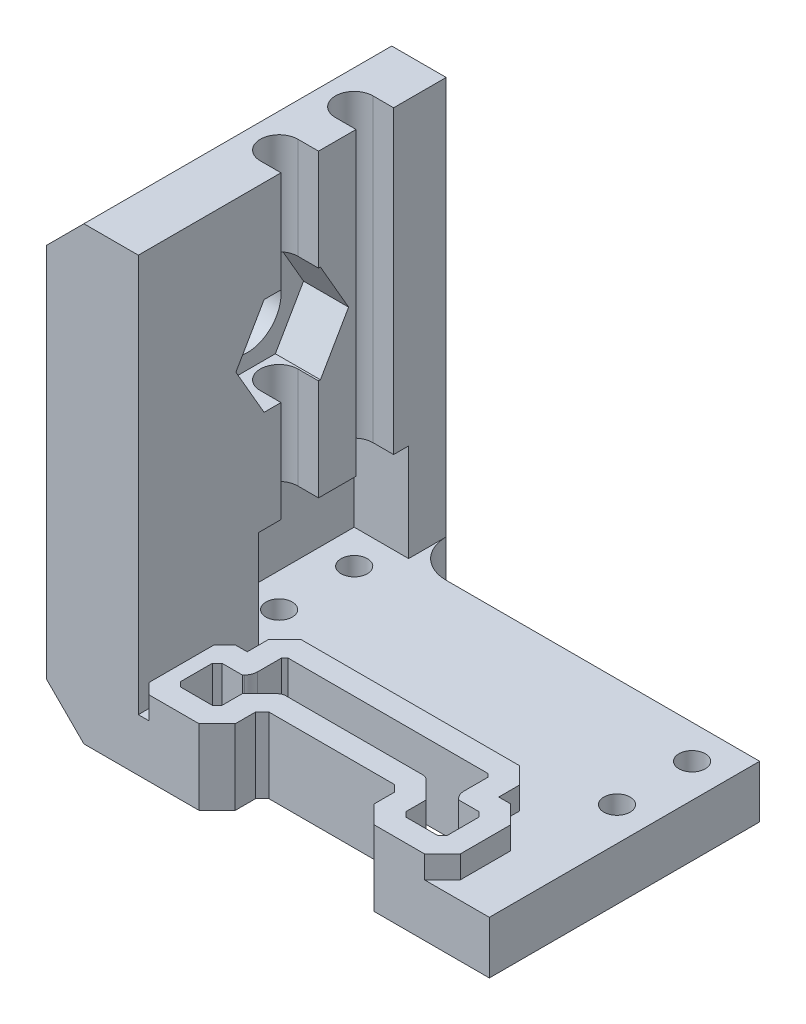
from build123d import *

# Parameters (mm, degrees)
BOSS_EXTRUDE1_DEPTH = 400
BOSS_EXTRUDE2_DEPTH = 10
SKETCH3_R           = 43.000999871
CUT_EXTRUDE1_DEPTH  = 447.360216168
BOSS_EXTRUDE3_DEPTH = 7
SKETCH5_R           = 1.75
CUT_EXTRUDE2_DEPTH  = 33
SKETCH6_W           = 36.000000185
SKETCH6_H           = 60
BOSS_EXTRUDE4_DEPTH = 5
SKETCH7_W           = 7.24997928
SKETCH7_H           = 16
BOSS_EXTRUDE5_DEPTH = 53
SKETCH8_W           = 12.24997928
SKETCH8_H           = 60
BOSS_EXTRUDE6_DEPTH = 5
FILLET1_R           = 5
SKETCH10_W          = 20.000000185
SKETCH10_H          = 40
BOSS_EXTRUDE7_DEPTH = 7.24997928
CUT_EXTRUDE3_DEPTH  = 6
CUT_EXTRUDE4_DEPTH  = 68.845857758
SKETCH12_R          = 4.5
CUT_EXTRUDE5_DEPTH  = 16
CHAMFER2_SIZE       = 5
CHAMFER3_SIZE       = 5
SKETCH13_R          = 6.5
SKETCH13_R_2        = 4.5
BOSS_EXTRUDE8_DEPTH = 1
FILLET2_R           = 1


with BuildPart() as part:
    # Sketch1 → Boss-Extrude1 (new body)
    with BuildSketch(Plane(origin=(0, 200, 0), x_dir=(1, 0, 0), z_dir=(0, 1, 0))):
        with BuildLine():
            Line((1e-09, -3.855700002), (0.25, -4.00003757))
            Line((0.25, -4.00003757), (9.078700232, -4.00003757))
            ThreePointArc((9.078700232, -4.00003757), (9.652725366, -4.114218268), (10.139360377, -4.439377387))
            Line((10.139360377, -4.439377387), (12.500020747, -6.800037757))
            Line((12.500020747, -6.800037757), (12.500020747, -9.500037757))
            Line((12.500020747, -9.500037757), (13.00002072, -10.000037755))
            Line((13.00002072, -10.000037755), (17.00002072, -10.000037755))
            Line((17.00002072, -10.000037755), (17.500020747, -9.500037752))
            Line((17.500020747, -9.500037752), (17.500020747, -5.500037752))
            Line((17.500020747, -5.500037752), (17.00002075, -5.0000377))
            Line((17.00002075, -5.0000377), (14.30002072, -5.0000377))
            Line((14.30002072, -5.0000377), (14.085807141, -4.785824121))
            ThreePointArc((14.085807141, -4.785824121), (13.652261651, -4.136977442), (13.50002072, -3.371610598))
            Line((13.50002072, -3.371610598), (13.50002072, -0.30003757))
            Line((13.50002072, -0.30003757), (13.20002072, -3.757e-05))
            Line((13.20002072, -3.757e-05), (7.50002072, -3.757e-05))
            Line((7.50002072, -3.757e-05), (7.40002072, -0.10003757))
            Line((7.40002072, -0.10003757), (-7.40002072, -0.10003757))
            Line((-7.40002072, -0.10003757), (-7.50002072, -3.757e-05))
            Line((-7.50002072, -3.757e-05), (-13.20002072, -3.757e-05))
            Line((-13.20002072, -3.757e-05), (-13.50002072, -0.30003757))
            Line((-13.50002072, -0.30003757), (-13.50002072, -3.371610628))
            ThreePointArc((-13.50002072, -3.371610628), (-13.652261651, -4.136977472), (-14.085807141, -4.785824151))
            Line((-14.085807141, -4.785824151), (-14.30002069, -5.0000377))
            Line((-14.30002069, -5.0000377), (-17.00002072, -5.0000377))
            Line((-17.00002072, -5.0000377), (-17.50002072, -5.50003767))
            Line((-17.50002072, -5.50003767), (-17.50002072, -9.50003767))
            Line((-17.50002072, -9.50003767), (-17.000020665, -10.000037755))
            Line((-17.000020665, -10.000037755), (-13.00002072, -10.000037755))
            Line((-13.00002072, -10.000037755), (-12.500020741, -9.500037764))
            Line((-12.500020741, -9.500037764), (-12.500020741, -6.800037764))
            Line((-12.500020741, -6.800037764), (-10.139360364, -4.439377387))
            ThreePointArc((-10.139360364, -4.439377387), (-9.652725352, -4.114218268), (-9.078700218, -4.00003757))
            Line((-9.078700218, -4.00003757), (-0.25, -4.00003757))
            Line((-0.25, -4.00003757), (1e-09, -3.855700002))
        make_face()
    extrude(amount=-BOSS_EXTRUDE1_DEPTH)

    # Sketch3 → Cut-Extrude1 (cut)
    with BuildSketch(Plane(origin=(0, 200, 0), x_dir=(1, 0, 0), z_dir=(0, 1, 0))):
        with Locations((0, -0.10003757)):
            Circle(SKETCH3_R)
    extrude(amount=-CUT_EXTRUDE1_DEPTH, mode=Mode.SUBTRACT)


with BuildPart() as body_2:
    # Sketch2 → Boss-Extrude2 (new body)
    with BuildSketch(Plane(origin=(0, 210, 0), x_dir=(1, 0, 0), z_dir=(0, 1, 0))):
        Polygon((-8.353826469, -7.25003757), (8.353826482, -7.25003757), (9.250020747, -8.146231835), (9.250020747, -10.846231788), (11.653826595, -13.250037755), (18.34621475, -13.250037755), (20.750020747, -10.846231878), (20.750020747, -4.153843779), (18.346214932, -1.7500377), (16.75002072, -1.7500377), (16.75002072, 1.046156508), (14.546214798, 3.24996243), (-14.546214798, 3.24996243), (-16.75002072, 1.046156508), (-16.75002072, -1.7500377), (-18.346214741, -1.7500377), (-20.75002072, -4.153843535), (-20.75002072, -10.846231691), (-18.3462148, -13.250037755), (-11.653826621, -13.250037755), (-9.250020741, -10.846231821), (-9.250020741, -8.146231842), align=None)
        with BuildLine():
            Line((13.303574111, 0.24996243), (-13.303574111, 0.24996243))
            Line((-13.303574111, 0.24996243), (-13.75002072, -0.196484179))
            Line((-13.75002072, -0.196484179), (-13.75002072, -3.371610628))
            ThreePointArc((-13.75002072, -3.371610628), (-13.883231534, -4.041306614), (-14.262583837, -4.609047456))
            Line((-14.262583837, -4.609047456), (-14.403574081, -4.7500377))
            Line((-14.403574081, -4.7500377), (-17.103574106, -4.7500377))
            Line((-17.103574106, -4.7500377), (-17.75002072, -5.396484275))
            Line((-17.75002072, -5.396484275), (-17.75002072, -9.603591056))
            Line((-17.75002072, -9.603591056), (-17.10357406, -10.250037755))
            Line((-17.10357406, -10.250037755), (-12.896467328, -10.250037755))
            Line((-12.896467328, -10.250037755), (-12.250020741, -9.603591153))
            Line((-12.250020741, -9.603591153), (-12.250020741, -6.903591155))
            Line((-12.250020741, -6.903591155), (-9.962583668, -4.616154083))
            ThreePointArc((-9.962583668, -4.616154083), (-9.557054494, -4.345188152), (-9.078700218, -4.25003757))
            Line((-9.078700218, -4.25003757), (9.078700232, -4.25003757))
            ThreePointArc((9.078700232, -4.25003757), (9.557054508, -4.345188152), (9.962583682, -4.616154083))
            Line((9.962583682, -4.616154083), (12.250020747, -6.903591148))
            Line((12.250020747, -6.903591148), (12.250020747, -9.603591144))
            Line((12.250020747, -9.603591144), (12.896467326, -10.250037755))
            Line((12.896467326, -10.250037755), (17.103574107, -10.250037755))
            Line((17.103574107, -10.250037755), (17.750020747, -9.603591147))
            Line((17.750020747, -9.603591147), (17.750020747, -5.39648437))
            Line((17.750020747, -5.39648437), (17.103574149, -4.7500377))
            Line((17.103574149, -4.7500377), (14.403574111, -4.7500377))
            Line((14.403574111, -4.7500377), (14.262583837, -4.609047426))
            ThreePointArc((14.262583837, -4.609047426), (13.883231534, -4.041306584), (13.75002072, -3.371610598))
            Line((13.75002072, -3.371610598), (13.75002072, -0.196484179))
            Line((13.75002072, -0.196484179), (13.303574111, 0.24996243))
        make_face(mode=Mode.SUBTRACT)
    extrude(amount=BOSS_EXTRUDE2_DEPTH)

    # Sketch4 → Boss-Extrude3 (add)
    with BuildSketch(Plane(origin=(0, 210, 0), x_dir=(-1, 0, 0), z_dir=(0, -1, 0))):
        Polygon((27, -13.250037755), (27, 22.74996243), (-27, 22.74996243), (-27, -13.250037755), (-18.34621475, -13.250037755), (-20.750020747, -10.846231878), (-20.750020747, -4.153843779), (-18.346214932, -1.7500377), (-16.75002072, -1.7500377), (-16.75002072, 1.046156508), (-14.546214798, 3.24996243), (14.546214798, 3.24996243), (16.75002072, 1.046156508), (16.75002072, -1.7500377), (18.346214741, -1.7500377), (20.75002072, -4.153843535), (20.75002072, -10.846231691), (18.3462148, -13.250037755), align=None)
    extrude(amount=-BOSS_EXTRUDE3_DEPTH)

    # Sketch5 → Cut-Extrude2 (cut)
    with BuildSketch(Plane(origin=(0, 210, 0), x_dir=(-1, 0, 0), z_dir=(0, -1, 0))):
        with Locations(Location((22.5, 18.24996243, 0), (0, 0, 90))):
            Circle(SKETCH5_R)
        with Locations(Location((22.5, 8.24996243, 0), (0, 0, 90))):
            Circle(SKETCH5_R)
        with Locations(Location((-22.5, 8.24996243, 0), (0, 0, 90))):
            Circle(SKETCH5_R)
        with Locations(Location((-22.5, 18.24996243, 0), (0, 0, 90))):
            Circle(SKETCH5_R)
    extrude(amount=-CUT_EXTRUDE2_DEPTH, mode=Mode.SUBTRACT)

    # Sketch6 → Boss-Extrude4 (add)
    with BuildSketch(Plane.ZY.offset(27)):
        with Locations((-4.749962337, 240)):
            Rectangle(SKETCH6_W, SKETCH6_H)
    extrude(amount=BOSS_EXTRUDE4_DEPTH)

    # Sketch7 → Boss-Extrude5 (add)
    with BuildSketch(Plane(origin=(0, 217, 0), x_dir=(1, 0, 0), z_dir=(0, 1, 0))):
        with Locations((-23.37501036, -5.250037755)):
            Rectangle(SKETCH7_W, SKETCH7_H)
    extrude(amount=BOSS_EXTRUDE5_DEPTH)

    # Sketch8 → Boss-Extrude6 (add)
    with BuildSketch(Plane(origin=(0, 0, -22.74996243), x_dir=(-1, 0, 0), z_dir=(0, 0, -1))):
        with Locations((25.87501036, 240)):
            Rectangle(SKETCH8_W, SKETCH8_H)
    extrude(amount=BOSS_EXTRUDE6_DEPTH)

    # Fillet1
    fillet1_edges = [body_2.edges().sort_by_distance(p)[0] for p in [
        (-19.75002072, 213.5, -22.74996243),
    ]]
    fillet(fillet1_edges, radius=FILLET1_R - 0.0001)  # a hair under: the kernel refuses the full size

    # Sketch10 → Boss-Extrude7 (add)
    with BuildSketch(Plane(origin=(-27, 0, 0), x_dir=(0, 0, -1), z_dir=(1, 0, 0))):
        with Locations((12.749962337, 250)):
            Rectangle(SKETCH10_W, SKETCH10_H)
    extrude(amount=BOSS_EXTRUDE7_DEPTH)

    # Sketch9 → Cut-Extrude3 (cut)
    with BuildSketch(Plane(origin=(-19.75002072, 0, 0), x_dir=(0, 0, -1), z_dir=(1, 0, 0))):
        Polygon((14.755515837, 250), (11.002739087, 256.5), (3.497185588, 256.5), (-0.255591162, 250), (3.497185588, 243.5), (11.002739087, 243.5), align=None)
    extrude(amount=-CUT_EXTRUDE3_DEPTH, mode=Mode.SUBTRACT)

    # Sketch11 → Cut-Extrude4 (cut, through all)
    with BuildSketch(Plane(origin=(0, 217, 0), x_dir=(1, 0, 0), z_dir=(0, 1, 0))):
        with BuildLine():
            Line((-22.5, 20.74996243), (-17.824832595, 20.74996243))
            Line((-17.824832595, 20.74996243), (-17.824832595, 15.74996243))
            Line((-17.824832595, 15.74996243), (-22.5, 15.74996243))
            ThreePointArc((-22.5, 15.74996243), (-25, 18.24996243), (-22.5, 20.74996243))
        make_face()
        with BuildLine():
            Line((-22.5, 10.74996243), (-17.824832595, 10.74996243))
            Line((-17.824832595, 10.74996243), (-17.824832595, 5.74996243))
            Line((-17.824832595, 5.74996243), (-22.5, 5.74996243))
            ThreePointArc((-22.5, 5.74996243), (-25, 8.24996243), (-22.5, 10.74996243))
        make_face()
    extrude(amount=CUT_EXTRUDE4_DEPTH, mode=Mode.SUBTRACT)

    # Sketch12 → Cut-Extrude5 (cut)
    with BuildSketch(Plane(origin=(-25.75002072, 0, 0), x_dir=(0, 0, -1), z_dir=(1, 0, 0))):
        with Locations((7.249962338, 250)):
            Circle(SKETCH12_R)
    extrude(amount=-CUT_EXTRUDE5_DEPTH, mode=Mode.SUBTRACT)

    # Chamfer2
    chamfer2_edges = [body_2.edges().sort_by_distance(p)[0] for p in [
        (-32, 270, -7.249962337),
    ]]
    chamfer(chamfer2_edges, length=CHAMFER2_SIZE)

    # Chamfer3
    chamfer3_edges = [body_2.edges().sort_by_distance(p)[0] for p in [
        (-32, 210, -7.249962338),
    ]]
    chamfer(chamfer3_edges, length=CHAMFER3_SIZE)

    # Sketch13 → Boss-Extrude8 (add)
    with BuildSketch(Plane.ZY.offset(32)):
        with Locations(Location((-7.249962338, 250, 0), (0, 0, 180))):
            Circle(SKETCH13_R)
        with Locations(Location((-7.249962338, 250, 0), (0, 0, 180))):
            Circle(SKETCH13_R_2, mode=Mode.SUBTRACT)
    extrude(amount=BOSS_EXTRUDE8_DEPTH)

    # Fillet2
    fillet2_edges = [body_2.edges().sort_by_distance(p)[0] for p in [
        (-32, 250, -0.749962338),
    ]]
    fillet(fillet2_edges, radius=FILLET2_R - 0.0001)  # a hair under: the kernel refuses the full size


solid = body_2.part
